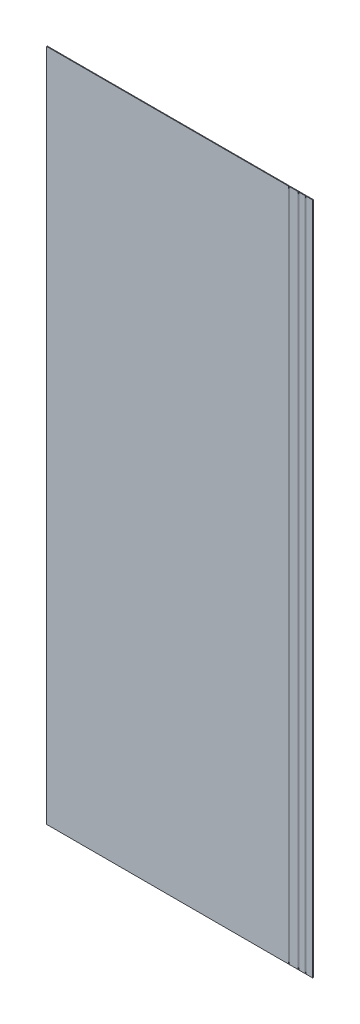
from build123d import *

# Parameters (mm, degrees)
BRIDA_BASE2_DEPTH          = 1810
DESDOBLAR1_DEPTH           = 1810
DESDOBLAR1_2_DEPTH         = 1810
CORTAR_EXTRUIR2_DEPTH      = 1924.175397617
CORTAR_EXTRUIR2_DEPTH_BACK = 1924.175397617


# Read off the part's stored shape, not the designer's step: Desdoblar1
# Sheet-metal steps are written as plain solids
with BuildPart() as part:
    # Croquis4 → Brida base2 (new body)
    with BuildSketch(Plane(origin=(0, 0, 0), x_dir=(1, 0, 0), z_dir=(0, 1, 0))):
        with BuildLine():
            Line((-650, 0), (-0.7366, 0))
            ThreePointArc((-0.7366, 0), (-0.215745145, 0.215745145), (0, 0.7366))
            Line((0, 0.7366), (0, 24.2634))
            ThreePointArc((0, 24.2634), (-0.215745145, 24.784254855), (-0.7366, 25))
            Line((-0.7366, 25), (-17.3634, 25))
            ThreePointArc((-17.3634, 25), (-19.227757739, 25.772242261), (-20, 27.6366))
            Line((-20, 27.6366), (-20, 45))
            Line((-20, 45), (-18.1, 45))
            Line((-18.1, 45), (-18.1, 27.6366))
            ThreePointArc((-18.1, 27.6366), (-17.884254855, 27.115745145), (-17.3634, 26.9))
            Line((-17.3634, 26.9), (-0.7366, 26.9))
            ThreePointArc((-0.7366, 26.9), (1.127757739, 26.127757739), (1.9, 24.2634))
            Line((1.9, 24.2634), (1.9, 0.7366))
            ThreePointArc((1.9, 0.7366), (1.127757739, -1.127757739), (-0.7366, -1.9))
            Line((-0.7366, -1.9), (-650, -1.9))
            Line((-650, -1.9), (-650, 0))
        make_face()
    extrude(amount=BRIDA_BASE2_DEPTH)

    # Desdoblar1 outline → Desdoblar1 (cut)
    with BuildSketch(Plane(origin=(0, 0, 0), x_dir=(1, 0, 0), z_dir=(0, 1, 0))):
        with BuildLine():
            Line((-0.7366, 0), (1.795016084, 0))
            ThreePointArc((1.795016084, 0), (1.873622072, 0.364578098), (1.9, 0.7366))
            Line((1.9, 0.7366), (1.9, 24.2634))
            ThreePointArc((1.9, 24.2634), (1.127757739, 26.127757739), (-0.7366, 26.9))
            Line((-0.7366, 26.9), (-17.3634, 26.9))
            ThreePointArc((-17.3634, 26.9), (-17.884254855, 27.115745145), (-18.1, 27.6366))
            Line((-18.1, 27.6366), (-18.1, 45))
            Line((-18.1, 45), (-20, 45))
            Line((-20, 45), (-20, 27.6366))
            ThreePointArc((-20, 27.6366), (-19.227757739, 25.772242261), (-17.3634, 25))
            Line((-17.3634, 25), (-0.7366, 25))
            ThreePointArc((-0.7366, 25), (-0.215745145, 24.784254855), (0, 24.2634))
            Line((0, 24.2634), (0, 0.7366))
            ThreePointArc((0, 0.7366), (-0.215745145, 0.215745145), (-0.7366, 0))
        make_face()
    extrude(amount=DESDOBLAR1_DEPTH, mode=Mode.SUBTRACT)

    # Desdoblar1 2 outline → Desdoblar1 2 (add)
    with BuildSketch(Plane(origin=(0, 0, 0), x_dir=(1, 0, 0), z_dir=(0, 1, 0))):
        with BuildLine():
            Line((64.728315254, 0), (1.795016084, 0))
            ThreePointArc((1.795016084, 0), (0.846046517, -1.372164937), (-0.7366, -1.9))
            Line((-0.7366, -1.9), (64.728315254, -1.9))
            Line((64.728315254, -1.9), (64.728315254, 0))
        make_face()
    extrude(amount=DESDOBLAR1_2_DEPTH)

    # Croquis15 → Cortar-Extruir2 (cut, two sides: drawn at the far end of the back side and taken through both)
    with BuildSketch(Plane.XY.offset(1.9).offset(-CORTAR_EXTRUIR2_DEPTH_BACK)):
        with BuildLine():
            Line((-0.411947458, 0), (1.588052542, 0))
            Line((1.588052542, 0), (1.588052542, 4.05))
            ThreePointArc((1.588052542, 4.05), (1.309803985, 4.721751442), (0.638052542, 5))
            Line((0.638052542, 5), (0.538052542, 5))
            ThreePointArc((0.538052542, 5), (-0.1336989, 4.721751442), (-0.411947458, 4.05))
            Line((-0.411947458, 4.05), (-0.411947458, 0))
        make_face()
        with BuildLine():
            Line((45.040262712, 0), (47.040262712, 0))
            Line((47.040262712, 0), (47.040262712, 4.05))
            ThreePointArc((47.040262712, 4.05), (46.762014154, 4.721751442), (46.090262712, 5))
            Line((46.090262712, 5), (45.990262712, 5))
            ThreePointArc((45.990262712, 5), (45.31851127, 4.721751442), (45.040262712, 4.05))
            Line((45.040262712, 4.05), (45.040262712, 0))
        make_face()
        with BuildLine():
            Line((45.040262712, 1810), (45.040262712, 1805.95))
            ThreePointArc((45.040262712, 1805.95), (45.31851127, 1805.278248558), (45.990262712, 1805))
            Line((45.990262712, 1805), (46.090262712, 1805))
            ThreePointArc((46.090262712, 1805), (46.762014154, 1805.278248558), (47.040262712, 1805.95))
            Line((47.040262712, 1805.95), (47.040262712, 1810))
            Line((47.040262712, 1810), (45.040262712, 1810))
        make_face()
        with BuildLine():
            Line((25.764157627, 1810), (25.764157627, 1805.95))
            ThreePointArc((25.764157627, 1805.95), (26.042406185, 1805.278248558), (26.714157627, 1805))
            Line((26.714157627, 1805), (26.814157627, 1805))
            ThreePointArc((26.814157627, 1805), (27.485909069, 1805.278248558), (27.764157627, 1805.95))
            Line((27.764157627, 1805.95), (27.764157627, 1810))
            Line((27.764157627, 1810), (25.764157627, 1810))
        make_face()
        with BuildLine():
            Line((1.588052542, 1805.95), (1.588052542, 1810))
            Line((1.588052542, 1810), (-0.411947458, 1810))
            Line((-0.411947458, 1810), (-0.411947458, 1805.95))
            ThreePointArc((-0.411947458, 1805.95), (-0.1336989, 1805.278248558), (0.538052542, 1805))
            Line((0.538052542, 1805), (0.638052542, 1805))
            ThreePointArc((0.638052542, 1805), (1.309803985, 1805.278248558), (1.588052542, 1805.95))
        make_face()
        with BuildLine():
            Line((27.764157627, 0), (27.764157627, 4.05))
            ThreePointArc((27.764157627, 4.05), (27.485909069, 4.721751442), (26.814157627, 5))
            Line((26.814157627, 5), (26.714157627, 5))
            ThreePointArc((26.714157627, 5), (26.042406185, 4.721751442), (25.764157627, 4.05))
            Line((25.764157627, 4.05), (25.764157627, 0))
            Line((25.764157627, 0), (27.764157627, 0))
        make_face()
    extrude(amount=CORTAR_EXTRUIR2_DEPTH + CORTAR_EXTRUIR2_DEPTH_BACK, mode=Mode.SUBTRACT)


solid = part.part
